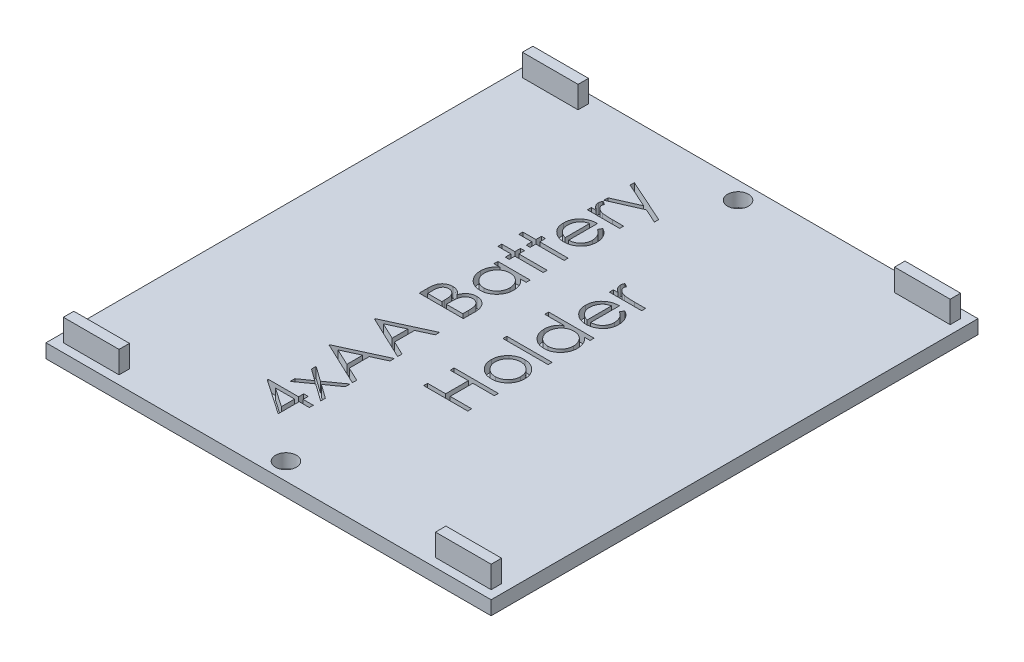
from build123d import *

# Parameters (mm, degrees)
SKETCH1_W               = 64
SKETCH1_H               = 70
BASE_DEPTH              = 2
SKETCH2_W               = 8
SKETCH2_H               = 1.5
BOSS_EXTRUDE2_DEPTH     = 3.175
MIRROR3_COPY_1_SKETCH_W = 8
MIRROR3_COPY_1_SKETCH_H = 1.5
MIRROR3_COPY_1_DEPTH    = 3.175
MIRROR3_COPY_2_SKETCH_W = 8
MIRROR3_COPY_2_SKETCH_H = 1.5
MIRROR3_COPY_2_DEPTH    = 3.175
SKETCH4_W               = 6.512820513
SKETCH4_H               = 0.569871795
LETTERS_DEPTH           = 1.5
SKETCH7_R               = 1.5
CUT_EXTRUDE3_DEPTH      = 48.529786854


with BuildPart() as part:
    # Sketch1 → Base (new body)
    with BuildSketch(Plane(origin=(0, 0, 0), x_dir=(1, 0, 0), z_dir=(0, 1, 0))):
        Rectangle(SKETCH1_W, SKETCH1_H)
    extrude(amount=BASE_DEPTH)

    # Sketch2 → Boss-Extrude2 (add)
    with BuildSketch(Plane(origin=(0, 2, 0), x_dir=(1, 0, 0), z_dir=(0, 1, 0))):
        with Locations((-26.75, 33)):
            Rectangle(SKETCH2_W, SKETCH2_H)
    boss_extrude2 = extrude(amount=BOSS_EXTRUDE2_DEPTH)

    # Mirror2: Boss-Extrude2 across plane
    add(boss_extrude2.mirror(Plane.XY))

    # Mirror3 copy 1 sketch → Mirror3 copy 1 (add)
    with BuildSketch(Plane(origin=(0, 2, 0), x_dir=(-1, 0, 0), z_dir=(0, 1, 0))):
        with Locations((-26.75, 33)):
            Rectangle(MIRROR3_COPY_1_SKETCH_W, MIRROR3_COPY_1_SKETCH_H)
    extrude(amount=MIRROR3_COPY_1_DEPTH)

    # Mirror3 copy 2 sketch → Mirror3 copy 2 (add)
    with BuildSketch(Plane(origin=(0, 2, 0), x_dir=(-1, 0, 0), z_dir=(0, 1, 0))):
        with Locations((-26.75, -33)):
            Rectangle(MIRROR3_COPY_2_SKETCH_W, MIRROR3_COPY_2_SKETCH_H)
    extrude(amount=MIRROR3_COPY_2_DEPTH)

    # Sketch4 → Letters (cut)
    # profile 1 of 17: a face of its own
    with BuildSketch(Plane(origin=(-14.943623663, 2, 1.769971189), x_dir=(1, 0, 0), z_dir=(0, 1, 0))):
        Polygon((3.43080315, -21.914053251), (3.43080315, -21.798298042), (7.826956997, -21.798298042), (7.826956997, -21.065605735), (8.478239048, -21.065605735), (8.478239048, -21.798298042), (9.943623663, -21.798298042), (9.943623663, -22.368169837), (8.478239048, -22.368169837), (8.478239048, -25.380349324), align=None)
        Polygon((7.826956997, -22.368169837), (5.069184561, -22.368169837), (7.826956997, -24.260958299), align=None, mode=Mode.SUBTRACT)
    # profile 2 of 17: a face of its own
    with BuildSketch(Plane(origin=(-14.943623663, 2, 1.769971189), x_dir=(1, 0, 0), z_dir=(0, 1, 0))):
        Polygon((5.303239048, -20.49573394), (5.303239048, -19.817739148), (6.977237445, -18.623298042), (5.303239048, -17.428856936), (5.303239048, -16.750862145), (7.451706596, -18.283664629), (9.943623663, -16.506631376), (9.943623663, -17.184626167), (7.927447782, -18.623298042), (9.943623663, -20.061969917), (9.943623663, -20.739964709), (7.451706596, -18.96165942), align=None)
    # profile 3 of 17: a face of its own
    with BuildSketch(Plane(origin=(-14.943623663, 2, 1.769971189), x_dir=(1, 0, 0), z_dir=(0, 1, 0))):
        Polygon((3.593623663, -13.087400606), (9.943623663, -10.156631376), (9.943623663, -10.776112545), (7.908367253, -11.714874565), (7.908367253, -14.59349035), (9.943623663, -15.55896511), (9.943623663, -16.18099035), (3.593623663, -13.168810863), align=None)
        Polygon((4.831313968, -13.134465911), (7.257085202, -14.284385783), (7.257085202, -12.015074885), align=None, mode=Mode.SUBTRACT)
    # profile 4 of 17: a face of its own
    with BuildSketch(Plane(origin=(-14.943623663, 2, 1.769971189), x_dir=(1, 0, 0), z_dir=(0, 1, 0))):
        Polygon((3.593623663, -6.574580093), (9.943623663, -3.643810863), (9.943623663, -4.263292033), (7.908367253, -5.202054052), (7.908367253, -8.080669837), (9.943623663, -9.046144597), (9.943623663, -9.668169837), (3.593623663, -6.65599035), align=None)
        Polygon((4.831313968, -6.621645398), (7.257085202, -7.77156527), (7.257085202, -5.502254372), align=None, mode=Mode.SUBTRACT)
    # profile 5 of 17: a face of its own
    with BuildSketch(Plane(origin=(-14.943623663, 2, 1.769971189), x_dir=(1, 0, 0), z_dir=(0, 1, 0))):
        with BuildLine():
            Line((3.593623663, -0.224580093), (3.593623663, 1.014382246))
            add(Edge.make_bspline(
                [(3.593623663, 1.014382246), (3.593937505, 1.075032013), (3.594545808, 1.192586356), (3.604199138, 1.363514344), (3.617032327, 1.52366793), (3.638559312, 1.672764102), (3.660879955, 1.811773006), (3.693641316, 1.93928341), (3.729827432, 2.056363373), (3.785504684, 2.196952443), (3.871972157, 2.356470008), (4.000211636, 2.527921542), (4.153960416, 2.676957677), (4.329169279, 2.803682568), (4.521918882, 2.90538199), (4.728062157, 2.978026234), (4.944130988, 3.024695663), (5.09226615, 3.029434985), (5.167131275, 3.031830163)],
                knots=[0, 0, 0, 0, 1.00128172, 1.940733171, 2.826250472, 3.653024905, 4.427672124, 5.149348099, 5.824709082, 6.450061444, 7.643590664, 8.808605388, 9.972104426, 11.165284501, 12.367876273, 13.557044126, 14.765369432, 16, 16, 16, 16], degree=3))
            add(Edge.make_bspline(
                [(5.167131275, 3.031830163), (5.237254972, 3.029835155), (5.375054648, 3.025914776), (5.576255016, 2.988883444), (5.767584804, 2.930109428), (5.948880263, 2.848881366), (6.116766562, 2.744223554), (6.270723634, 2.618828784), (6.40493275, 2.46816797), (6.479934982, 2.355232116), (6.518032718, 2.29786582)],
                knots=[0, 0, 0, 0, 1.044641374, 2.052818814, 3.038628718, 4.023282556, 5.005660861, 5.98021751, 6.974042014, 8, 8, 8, 8], degree=3))
            add(Edge.make_bspline(
                [(6.518032718, 2.29786582), (6.545736755, 2.36999563), (6.598741441, 2.507997825), (6.69230658, 2.698018531), (6.794441874, 2.8611364), (6.904255556, 3.000537857), (7.024368761, 3.119132412), (7.155757354, 3.221842155), (7.298313772, 3.310636729), (7.451514075, 3.386200297), (7.614059515, 3.445556422), (7.78396476, 3.489182351), (7.960578477, 3.514988037), (8.080432082, 3.518508328), (8.141149705, 3.520291701)],
                knots=[0, 0, 0, 0, 1.272586185, 2.434772614, 3.483318042, 4.437947805, 5.351807173, 6.25737843, 7.180033415, 8.1141739, 9.066731021, 10.025721652, 10.999834114, 12, 12, 12, 12], degree=3))
            add(Edge.make_bspline(
                [(8.141149705, 3.520291701), (8.203138425, 3.518519811), (8.325102969, 3.515033567), (8.504269396, 3.489301514), (8.675505755, 3.445762469), (8.839840724, 3.385687144), (8.99692975, 3.307819523), (9.146203753, 3.211687586), (9.287973294, 3.098640832), (9.422488579, 2.970879728), (9.545574294, 2.828499973), (9.6513865, 2.671588318), (9.742369917, 2.50444338), (9.816445371, 2.324928368), (9.873594534, 2.133501548), (9.913411782, 1.930269441), (9.940285601, 1.715566738), (9.942492096, 1.568227968), (9.943623663, 1.492667503)],
                knots=[0, 0, 0, 0, 0.978680899, 1.925582087, 2.851223405, 3.764209995, 4.683484765, 5.614004905, 6.562443559, 7.542772147, 8.539900013, 9.527881485, 10.525548727, 11.540192123, 12.58875426, 13.674701727, 14.807505862, 16, 16, 16, 16], degree=3))
            Line((9.943623663, 1.492667503), (9.943623663, -0.224580093))
            Line((9.943623663, -0.224580093), (3.593623663, -0.224580093))
        make_face()
        with BuildLine():
            Line((4.244905715, 0.345291701), (6.280162125, 0.345291701))
            Line((6.280162125, 0.345291701), (6.280162125, 0.728174314))
            add(Edge.make_bspline(
                [(6.280162125, 0.728174314), (6.27943655, 0.784142842), (6.278034593, 0.892285446), (6.274018639, 1.048894399), (6.262773622, 1.194264081), (6.251531816, 1.328143531), (6.233253688, 1.450322025), (6.211496381, 1.560528548), (6.188486516, 1.660493784), (6.149350985, 1.775769975), (6.091531512, 1.906549207), (6.001713294, 2.045874071), (5.894818274, 2.169270566), (5.770322499, 2.272222394), (5.634724709, 2.3572245), (5.489215326, 2.416771148), (5.336722536, 2.456469125), (5.231833895, 2.460109877), (5.178579593, 2.461958368)],
                knots=[0, 0, 0, 0, 1.156917035, 2.235399477, 3.236897345, 4.169954739, 5.01148057, 5.788325709, 6.491867502, 7.129259015, 8.302032419, 9.437271567, 10.542795419, 11.662606952, 12.764338259, 13.836858145, 14.901724648, 16, 16, 16, 16], degree=3))
            add(Edge.make_bspline(
                [(5.178579593, 2.461958368), (5.143331073, 2.461019818), (5.074187252, 2.45917875), (4.973064059, 2.443552627), (4.878045349, 2.418234161), (4.78821918, 2.383946133), (4.70581795, 2.337103598), (4.626904313, 2.282806946), (4.556204811, 2.215770021), (4.490315694, 2.140012343), (4.431345155, 2.053332047), (4.382497203, 1.953861605), (4.338224729, 1.844172479), (4.305451132, 1.721288744), (4.276631893, 1.587756592), (4.258524571, 1.441767949), (4.246872338, 1.284247913), (4.245575877, 1.175106313), (4.244905715, 1.118689137)],
                knots=[0, 0, 0, 0, 0.911708768, 1.788416306, 2.640049961, 3.452993646, 4.268229297, 5.087074648, 5.92553149, 6.781184137, 7.681934069, 8.628939405, 9.643570426, 10.73771997, 11.914765019, 13.176320755, 14.540391495, 16, 16, 16, 16], degree=3))
            Line((4.244905715, 1.118689137), (4.244905715, 0.345291701))
        make_face(mode=Mode.SUBTRACT)
        with BuildLine():
            Line((6.931444176, 0.345291701), (9.292341612, 0.345291701))
            Line((9.292341612, 0.345291701), (9.292341612, 1.156850195))
            add(Edge.make_bspline(
                [(9.292341612, 1.156850195), (9.291576156, 1.214935599), (9.290100841, 1.326887558), (9.28664092, 1.488654245), (9.273552564, 1.638195702), (9.261478615, 1.775983681), (9.240832681, 1.90165249), (9.221348288, 2.016168782), (9.192425097, 2.117652693), (9.152673574, 2.236412347), (9.089036321, 2.369158191), (8.996062895, 2.514225505), (8.881319334, 2.640721954), (8.750820264, 2.749307347), (8.609319449, 2.838916729), (8.458666742, 2.903219936), (8.301792052, 2.943180243), (8.194804951, 2.948001827), (8.141149705, 2.950419907)],
                knots=[0, 0, 0, 0, 1.160376723, 2.23647316, 3.230273494, 4.158083346, 4.997711197, 5.773399541, 6.476071462, 7.102777513, 8.27340052, 9.405620712, 10.53304798, 11.669441455, 12.787990954, 13.865552736, 14.929550474, 16, 16, 16, 16], degree=3))
            add(Edge.make_bspline(
                [(8.141149705, 2.950419907), (8.107596779, 2.949920508), (8.041032138, 2.948929768), (7.943223973, 2.933920287), (7.848432394, 2.912206324), (7.756262389, 2.883608411), (7.668263675, 2.843630071), (7.584098778, 2.794619976), (7.502072221, 2.738519214), (7.39703011, 2.651966351), (7.277506758, 2.524236404), (7.161931491, 2.342717897), (7.067218679, 2.137464505), (7.027178156, 1.988248325), (7.006494256, 1.911167102)],
                knots=[0, 0, 0, 0, 0.723302347, 1.434937762, 2.129609326, 2.821140842, 3.513216847, 4.209993937, 4.920569932, 5.655069131, 7.14393391, 8.6716197, 10.280644748, 12, 12, 12, 12], degree=3))
            add(Edge.make_bspline(
                [(7.006494256, 1.911167102), (7.000225747, 1.880271457), (6.986634325, 1.813283325), (6.972287492, 1.704049572), (6.95950574, 1.579343067), (6.950051212, 1.438875847), (6.940278483, 1.282470192), (6.936477879, 1.109792068), (6.931943507, 0.921546654), (6.931614877, 0.790931922), (6.931444176, 0.723086173)],
                knots=[0, 0, 0, 0, 0.634451884, 1.375622551, 2.216452059, 3.157844607, 4.20941857, 5.370758133, 6.634282058, 8, 8, 8, 8], degree=3))
            Line((6.931444176, 0.723086173), (6.931444176, 0.345291701))
        make_face(mode=Mode.SUBTRACT)
    # profile 6 of 17: a face of its own
    with BuildSketch(Plane(origin=(-14.943623663, 2, 1.769971189), x_dir=(1, 0, 0), z_dir=(0, 1, 0))):
        with BuildLine():
            Line((5.303239048, 9.381830163), (9.943623663, 9.381830163))
            Line((9.943623663, 9.381830163), (9.943623663, 8.811958368))
            Line((9.943623663, 8.811958368), (9.140969416, 8.811958368))
            add(Edge.make_bspline(
                [(9.140969416, 8.811958368), (9.213492983, 8.747598242), (9.355234107, 8.621811867), (9.542106959, 8.413704558), (9.693422684, 8.190368578), (9.817407586, 7.957408086), (9.910164545, 7.712541172), (9.976211859, 7.457047679), (10.018646129, 7.190683514), (10.022885553, 7.008797974), (10.02503392, 6.916625836)],
                knots=[0, 0, 0, 0, 1.074325654, 2.099677833, 3.090439787, 4.057542011, 5.018572219, 5.985274637, 6.979019747, 8, 8, 8, 8], degree=3))
            add(Edge.make_bspline(
                [(10.02503392, 6.916625836), (10.02280893, 6.834678263), (10.018421152, 6.673074019), (9.984380972, 6.435349837), (9.929715416, 6.20658247), (9.853695231, 5.986555745), (9.75285574, 5.776693424), (9.632130904, 5.575198677), (9.488365398, 5.383115365), (9.324012833, 5.203371287), (9.145496213, 5.037850372), (8.955095007, 4.892596349), (8.753632541, 4.771487189), (8.543659533, 4.670213614), (8.323559608, 4.592205961), (8.094093889, 4.537825225), (7.85553369, 4.5038247), (7.693083412, 4.499438735), (7.610711003, 4.497214778)],
                knots=[0, 0, 0, 0, 1.033919861, 2.038935746, 3.024066025, 3.998881131, 4.97069526, 5.957263378, 6.95902576, 7.993208707, 9.027059324, 10.027763471, 11.009749337, 11.988697705, 12.965288445, 13.950418724, 14.960734635, 16, 16, 16, 16], degree=3))
            add(Edge.make_bspline(
                [(7.610711003, 4.497214778), (7.530041141, 4.499488026), (7.370561175, 4.503982115), (7.13601268, 4.537461528), (6.910100979, 4.593760644), (6.693553382, 4.672768882), (6.486107862, 4.774082143), (6.287617702, 4.897323101), (6.097536081, 5.042500656), (5.92033257, 5.20987288), (5.756646598, 5.391183106), (5.614390187, 5.585146089), (5.491532476, 5.786936899), (5.39418974, 5.999685504), (5.315433222, 6.220242966), (5.260944837, 6.450572789), (5.22883684, 6.689716653), (5.224187253, 6.852077974), (5.221828791, 6.93443433)],
                knots=[0, 0, 0, 0, 1.020392517, 2.01726096, 2.990465484, 3.961182959, 4.928053699, 5.906110375, 6.912531644, 7.948652711, 8.985773172, 9.998621852, 10.987621588, 11.969261332, 12.953316658, 13.946091881, 14.958173133, 16, 16, 16, 16], degree=3))
            add(Edge.make_bspline(
                [(5.221828791, 6.93443433), (5.224440189, 7.029137994), (5.229561017, 7.214847411), (5.272088028, 7.48652216), (5.344153349, 7.743413224), (5.441504795, 7.98824775), (5.573578097, 8.217655653), (5.735521588, 8.434492721), (5.934030582, 8.63414573), (6.084605027, 8.751662182), (6.161862846, 8.811958368)],
                knots=[0, 0, 0, 0, 1.039007978, 2.037445607, 3.008437381, 3.96246474, 4.921201921, 5.904967172, 6.925065498, 8, 8, 8, 8], degree=3))
            Line((6.161862846, 8.811958368), (5.303239048, 8.811958368))
            Line((5.303239048, 8.811958368), (5.303239048, 9.381830163))
        make_face()
        with BuildLine():
            add(Edge.make_bspline(
                [(5.791700586, 6.942066541), (5.794667009, 6.858766607), (5.800522254, 6.694345785), (5.846157483, 6.452940027), (5.922285953, 6.222054541), (6.025791529, 6.002048356), (6.158411712, 5.799056485), (6.314662774, 5.614453935), (6.497182174, 5.453932723), (6.699438066, 5.315884868), (6.917464945, 5.205063312), (7.145304617, 5.126642139), (7.37901403, 5.075017599), (7.537512181, 5.069737132), (7.617071179, 5.067086573)],
                knots=[0, 0, 0, 0, 1.031130969, 2.035288524, 3.029955243, 4.035265425, 5.037320146, 6.024362013, 7.021230137, 8.037832003, 9.049975902, 10.039737725, 11.016035826, 12, 12, 12, 12], degree=3))
            add(Edge.make_bspline(
                [(7.617071179, 5.067086573), (7.696151093, 5.070483677), (7.854000955, 5.077264568), (8.087690308, 5.125511858), (8.315018545, 5.207516707), (8.534797458, 5.318188409), (8.739029616, 5.457860982), (8.924827274, 5.618229528), (9.083522447, 5.803720248), (9.216462346, 6.008526996), (9.323782373, 6.227364682), (9.398473247, 6.457472327), (9.446691717, 6.694556672), (9.45232429, 6.855760003), (9.455162125, 6.9369784)],
                knots=[0, 0, 0, 0, 0.979154007, 1.954470061, 2.941101473, 3.965068436, 4.993389179, 5.998216918, 6.996159742, 8.005560442, 9.015493761, 10.005250788, 10.994993882, 12, 12, 12, 12], degree=3))
            add(Edge.make_bspline(
                [(9.455162125, 6.9369784), (9.452115684, 7.019420106), (9.446056615, 7.183388483), (9.400679576, 7.425780007), (9.32286612, 7.660203795), (9.218292884, 7.885060707), (9.088044227, 8.094329082), (8.935558235, 8.281513704), (8.759437633, 8.441664554), (8.563630344, 8.575001855), (8.350335697, 8.680744849), (8.123478696, 8.758062776), (7.882598867, 8.803268515), (7.717752316, 8.809021699), (7.633607638, 8.811958368)],
                knots=[0, 0, 0, 0, 1.01787422, 2.024450869, 3.03297362, 4.061474925, 5.080076323, 6.069755756, 7.033548292, 8.009625779, 8.9862229, 9.964937832, 10.961217871, 12, 12, 12, 12], degree=3))
            add(Edge.make_bspline(
                [(7.633607638, 8.811958368), (7.569494717, 8.810217277), (7.443300199, 8.806790259), (7.258011703, 8.780609083), (7.0806948, 8.738962288), (6.911163064, 8.680277094), (6.750353822, 8.603185764), (6.597112428, 8.510207674), (6.452235888, 8.399707787), (6.317719173, 8.273464895), (6.195025449, 8.135279456), (6.085507469, 7.989057933), (5.995539267, 7.83306792), (5.921078675, 7.669932725), (5.861825645, 7.499369304), (5.822296544, 7.319989751), (5.795154247, 7.133700732), (5.792863928, 7.006617174), (5.791700586, 6.942066541)],
                knots=[0, 0, 0, 0, 1.050140795, 2.067009409, 3.05949893, 4.030605086, 5.00011959, 5.97591094, 6.962425594, 7.979863591, 8.993523472, 9.986985069, 10.967611495, 11.937549037, 12.921786183, 13.919465291, 14.943216303, 16, 16, 16, 16], degree=3))
        make_face(mode=Mode.SUBTRACT)
    # profile 7 of 17: a face of its own
    with BuildSketch(Plane(origin=(-14.943623663, 2, 1.769971189), x_dir=(1, 0, 0), z_dir=(0, 1, 0))):
        Polygon((3.43080315, 11.25426606), (3.43080315, 11.824137855), (5.303239048, 11.824137855), (5.303239048, 12.638240419), (5.873110843, 12.638240419), (5.873110843, 11.824137855), (9.943623663, 11.824137855), (9.943623663, 11.25426606), (5.873110843, 11.25426606), (5.873110843, 10.440163496), (5.303239048, 10.440163496), (5.303239048, 11.25426606), align=None)
    # profile 8 of 17: a face of its own
    with BuildSketch(Plane(origin=(-14.943623663, 2, 1.769971189), x_dir=(1, 0, 0), z_dir=(0, 1, 0))):
        Polygon((3.43080315, 14.266445548), (3.43080315, 14.836317342), (5.303239048, 14.836317342), (5.303239048, 15.650419907), (5.873110843, 15.650419907), (5.873110843, 14.836317342), (9.943623663, 14.836317342), (9.943623663, 14.266445548), (5.873110843, 14.266445548), (5.873110843, 13.452342983), (5.303239048, 13.452342983), (5.303239048, 14.266445548), align=None)
    # profile 9 of 17: a face of its own
    with BuildSketch(Plane(origin=(-14.943623663, 2, 1.769971189), x_dir=(1, 0, 0), z_dir=(0, 1, 0))):
        with BuildLine():
            Line((8.478239048, 20.517226798), (8.744094416, 21.02349683))
            add(Edge.make_bspline(
                [(8.744094416, 21.02349683), (8.815638925, 20.983132127), (8.954836207, 20.904598402), (9.146087265, 20.770092842), (9.317115506, 20.627801195), (9.465182278, 20.47339409), (9.595943623, 20.311524469), (9.708732595, 20.139117921), (9.805584315, 19.957581698), (9.884945262, 19.764916268), (9.947335425, 19.561352425), (9.993410987, 19.345708948), (10.020130434, 19.116967648), (10.023373372, 18.960325915), (10.02503392, 18.880117423)],
                knots=[0, 0, 0, 0, 1.120611642, 2.180266485, 3.186550691, 4.152466804, 5.095166165, 6.022949561, 6.960161436, 7.899497276, 8.862391909, 9.862399089, 10.905440174, 12, 12, 12, 12], degree=3))
            add(Edge.make_bspline(
                [(10.02503392, 18.880117423), (10.022952616, 18.790959835), (10.018892595, 18.61703921), (9.983890553, 18.363874239), (9.926790699, 18.125514444), (9.847024656, 17.901973184), (9.742835044, 17.69379805), (9.615908699, 17.500574716), (9.466896778, 17.321289207), (9.294511869, 17.161583033), (9.110024079, 17.017830943), (8.917817546, 16.890897019), (8.718557901, 16.785269796), (8.513430696, 16.698035348), (8.302902063, 16.629223898), (8.085766278, 16.580325422), (7.862884348, 16.552397852), (7.712125173, 16.548099058), (7.636151708, 16.545932727)],
                knots=[0, 0, 0, 0, 1.14524686, 2.234044844, 3.276713788, 4.290115724, 5.276966211, 6.260758605, 7.254862358, 8.264742877, 9.274005885, 10.257798278, 11.220590477, 12.167824544, 13.118936889, 14.062732937, 15.023735098, 16, 16, 16, 16], degree=3))
            add(Edge.make_bspline(
                [(7.636151708, 16.545932727), (7.564859659, 16.547854312), (7.423568231, 16.55166264), (7.214443601, 16.575667068), (7.01119198, 16.618208971), (6.813644481, 16.676586016), (6.622131867, 16.751971849), (6.43653758, 16.844196018), (6.257059112, 16.953402189), (6.143841998, 17.037716897), (6.086812766, 17.080187535)],
                knots=[0, 0, 0, 0, 1.024358464, 2.0301432, 3.019427413, 4.004406732, 4.986367066, 5.972626655, 6.978780325, 8, 8, 8, 8], degree=3))
            add(Edge.make_bspline(
                [(6.086812766, 17.080187535), (6.017993899, 17.137615155), (5.882757229, 17.250466769), (5.70668112, 17.443319463), (5.556063061, 17.649331207), (5.433188551, 17.870574231), (5.338678625, 18.106675865), (5.271454965, 18.356418315), (5.229625333, 18.62049186), (5.22446715, 18.801517165), (5.221828791, 18.89410981)],
                knots=[0, 0, 0, 0, 1.030811313, 2.025658015, 2.997072178, 3.962767568, 4.930766827, 5.917075773, 6.934604948, 8, 8, 8, 8], degree=3))
            add(Edge.make_bspline(
                [(5.221828791, 18.89410981), (5.224273119, 18.989270223), (5.229068333, 19.17595326), (5.27392138, 19.448077087), (5.344186372, 19.706071974), (5.446559129, 19.947808821), (5.573457155, 20.177012436), (5.733850318, 20.388407725), (5.919500635, 20.587797624), (6.062422456, 20.703733901), (6.135150106, 20.762729602)],
                knots=[0, 0, 0, 0, 1.056389096, 2.072394598, 3.055233004, 4.020130009, 4.981825462, 5.957811105, 6.960805292, 8, 8, 8, 8], degree=3))
            add(Edge.make_bspline(
                [(6.135150106, 20.762729602), (6.189948032, 20.80287419), (6.299179133, 20.882896152), (6.477289661, 20.983130176), (6.663636025, 21.070138593), (6.861230421, 21.139685536), (7.067731659, 21.19600006), (7.28461599, 21.236743145), (7.51181883, 21.260636596), (7.66662558, 21.265333233), (7.74554674, 21.267727599)],
                knots=[0, 0, 0, 0, 0.94817472, 1.890038105, 2.849395472, 3.817997239, 4.812318967, 5.836947057, 6.897266129, 8, 8, 8, 8], degree=3))
            Line((7.74554674, 21.267727599), (7.74554674, 17.115804522))
            add(Edge.make_bspline(
                [(7.74554674, 17.115804522), (7.806689011, 17.118597808), (7.926922821, 17.124090692), (8.102855527, 17.149699595), (8.270447162, 17.190065227), (8.428440681, 17.246796241), (8.578899627, 17.315497517), (8.720707894, 17.39965446), (8.853219567, 17.500056223), (8.977619945, 17.612044277), (9.088401612, 17.736698579), (9.187555549, 17.867840134), (9.270659989, 18.007347031), (9.338114931, 18.154119268), (9.390922105, 18.307919507), (9.426968008, 18.468796204), (9.451110902, 18.636432786), (9.453795437, 18.750706904), (9.455162125, 18.808883448)],
                knots=[0, 0, 0, 0, 1.094153842, 2.151609401, 3.174256925, 4.172055639, 5.149267565, 6.128595816, 7.11444997, 8.118368179, 9.117203808, 10.09244225, 11.054858984, 12.015122123, 12.976791628, 13.957293641, 14.960065497, 16, 16, 16, 16], degree=3))
            add(Edge.make_bspline(
                [(9.455162125, 18.808883448), (9.45406782, 18.865765869), (9.451896509, 18.978631504), (9.430480609, 19.14667193), (9.396538265, 19.312281418), (9.347650967, 19.473815512), (9.290404601, 19.628920054), (9.223025997, 19.773348842), (9.146206762, 19.905192453), (9.058911323, 20.028898318), (8.951776893, 20.148237328), (8.819368102, 20.268496367), (8.660183165, 20.39459961), (8.54116933, 20.474812876), (8.478239048, 20.517226798)],
                knots=[0, 0, 0, 0, 0.991168677, 1.966668791, 2.94808785, 3.9350306, 4.905702032, 5.828266021, 6.709360349, 7.562606342, 8.463112863, 9.498839253, 10.677475166, 12, 12, 12, 12], degree=3))
        make_face()
        with BuildLine():
            add(Edge.make_bspline(
                [(7.175674945, 20.697855804), (7.100048815, 20.677082109), (6.954871215, 20.637203363), (6.75390558, 20.552274645), (6.574269929, 20.458933184), (6.418949407, 20.346568432), (6.280783152, 20.220499492), (6.161971797, 20.072869714), (6.052465649, 19.910081972), (5.961273096, 19.728893863), (5.886334769, 19.536450543), (5.831231933, 19.336707481), (5.798840835, 19.13133771), (5.794091857, 18.993016192), (5.791700586, 18.923366621)],
                knots=[0, 0, 0, 0, 1.155085888, 2.217389643, 3.210301801, 4.133263417, 5.03575695, 5.95948047, 6.920061569, 7.923798377, 8.943125483, 9.960783337, 10.973185325, 12, 12, 12, 12], degree=3))
            add(Edge.make_bspline(
                [(5.791700586, 18.923366621), (5.792797392, 18.866485437), (5.794965548, 18.754043293), (5.815962612, 18.588459866), (5.849702564, 18.429028905), (5.899311968, 18.276226305), (5.959676808, 18.129038469), (6.033877411, 17.987571752), (6.123587238, 17.853644735), (6.192116106, 17.769940539), (6.226736644, 17.72765348)],
                knots=[0, 0, 0, 0, 1.048823158, 2.073302879, 3.073550078, 4.050623576, 5.03253758, 6.005186856, 6.992227572, 8, 8, 8, 8], degree=3))
            add(Edge.make_bspline(
                [(6.226736644, 17.72765348), (6.254119167, 17.697362351), (6.30953472, 17.636060487), (6.405064062, 17.554236768), (6.50813463, 17.475309189), (6.623245548, 17.405170535), (6.747058724, 17.338514156), (6.880477593, 17.277772912), (7.024065319, 17.222544161), (7.12417164, 17.191540916), (7.175674945, 17.175590179)],
                knots=[0, 0, 0, 0, 0.879905587, 1.780714457, 2.708106151, 3.677566983, 4.684151534, 5.740052498, 6.837288539, 8, 8, 8, 8], degree=3))
            Line((7.175674945, 17.175590179), (7.175674945, 20.697855804))
        make_face(mode=Mode.SUBTRACT)
    # profile 10 of 17: a face of its own
    with BuildSketch(Plane(origin=(-14.943623663, 2, 1.769971189), x_dir=(1, 0, 0), z_dir=(0, 1, 0))):
        with BuildLine():
            Line((5.303239048, 22.244650676), (5.303239048, 22.814522471))
            Line((5.303239048, 22.814522471), (5.986321981, 22.814522471))
            add(Edge.make_bspline(
                [(5.986321981, 22.814522471), (5.922692219, 22.856566585), (5.801000795, 22.936975628), (5.640272101, 23.071250583), (5.505675407, 23.207321239), (5.399777493, 23.348760562), (5.31974453, 23.494181848), (5.263507873, 23.642358839), (5.228633812, 23.793653878), (5.22410017, 23.895572217), (5.221828791, 23.946633849)],
                knots=[0, 0, 0, 0, 1.280091057, 2.448164201, 3.510831157, 4.48793739, 5.405868014, 6.289422536, 7.142991551, 8, 8, 8, 8], degree=3))
            add(Edge.make_bspline(
                [(5.221828791, 23.946633849), (5.223988747, 23.986233041), (5.228432995, 24.067710953), (5.259658349, 24.191050794), (5.309511333, 24.318129629), (5.356392879, 24.400030817), (5.380833199, 24.442727599)],
                knots=[0, 0, 0, 0, 0.901110191, 1.854092781, 2.881294221, 4, 4, 4, 4], degree=3))
            Line((5.380833199, 24.442727599), (5.874382878, 24.129806926))
            add(Edge.make_bspline(
                [(5.874382878, 24.129806926), (5.862154109, 24.102394845), (5.838941566, 24.050361467), (5.811469633, 23.974243897), (5.795293614, 23.9040649), (5.792843027, 23.859354444), (5.791700586, 23.838510852)],
                knots=[0, 0, 0, 0, 1.180555205, 2.24091978, 3.179933427, 4, 4, 4, 4], degree=3))
            add(Edge.make_bspline(
                [(5.791700586, 23.838510852), (5.794724784, 23.79276672), (5.800893271, 23.69946195), (5.850079764, 23.56293453), (5.927264592, 23.42926635), (6.015155291, 23.324131697), (6.099581993, 23.242440101), (6.173473976, 23.183689577), (6.257095864, 23.130960107), (6.347215485, 23.079811122), (6.446094586, 23.032289852), (6.553894475, 22.989822617), (6.669724982, 22.950107577), (6.750264633, 22.927741897), (6.791520298, 22.916285291)],
                knots=[0, 0, 0, 0, 1.125322384, 2.295331465, 3.535939348, 4.916963136, 5.656144286, 6.429838446, 7.238666481, 8.090384391, 8.983239461, 9.940052224, 10.944811494, 12, 12, 12, 12], degree=3))
            add(Edge.make_bspline(
                [(6.791520298, 22.916285291), (6.828306848, 22.907684539), (6.910194857, 22.888538996), (7.046950996, 22.870420826), (7.208419934, 22.851798302), (7.394789248, 22.839080993), (7.606775347, 22.827067798), (7.843463722, 22.820431214), (8.105504914, 22.814733623), (8.288277618, 22.814595101), (8.384108439, 22.814522471)],
                knots=[0, 0, 0, 0, 0.566841273, 1.261806378, 2.068780918, 3.007109044, 4.065315289, 5.256255371, 6.561408263, 8, 8, 8, 8], degree=3))
            Line((8.384108439, 22.814522471), (9.943623663, 22.814522471))
            Line((9.943623663, 22.814522471), (9.943623663, 22.244650676))
            Line((9.943623663, 22.244650676), (5.303239048, 22.244650676))
        make_face()
    # profile 11 of 17: a face of its own
    with BuildSketch(Plane(origin=(-14.943623663, 2, 1.769971189), x_dir=(1, 0, 0), z_dir=(0, 1, 0))):
        Polygon((5.303239048, 24.605548112), (5.303239048, 25.21994114), (8.857305554, 26.790904682), (5.303239048, 28.386036894), (5.303239048, 29.001701958), (11.653239048, 26.152342983), (11.653239048, 25.536677919), (9.548020699, 26.481800115), align=None)
    # profile 12 of 17: a face of its own
    with BuildSketch(Plane(origin=(-14.943623663, 2, 1.769971189), x_dir=(1, 0, 0), z_dir=(0, 1, 0))):
        Polygon((15.421187766, -11.41849035), (15.421187766, -10.848618555), (18.026315971, -10.848618555), (18.026315971, -7.592208299), (15.421187766, -7.592208299), (15.421187766, -7.022336504), (21.771187766, -7.022336504), (21.771187766, -7.592208299), (18.677598022, -7.592208299), (18.677598022, -10.848618555), (21.771187766, -10.848618555), (21.771187766, -11.41849035), align=None)
    # profile 13 of 17: a face of its own
    with BuildSketch(Plane(origin=(-14.943623663, 2, 1.769971189), x_dir=(1, 0, 0), z_dir=(0, 1, 0))):
        with BuildLine():
            add(Edge.make_bspline(
                [(17.049392894, -3.315625767), (17.051246897, -3.228555886), (17.054882142, -3.057833129), (17.093735009, -2.80781025), (17.153148084, -2.569149789), (17.235283632, -2.340937697), (17.345378028, -2.126096704), (17.476749171, -1.921497447), (17.632383305, -1.727700874), (17.7527758, -1.611544806), (17.813886083, -1.552584901)],
                knots=[0, 0, 0, 0, 1.054011418, 2.066658804, 3.057071809, 4.030435133, 4.997543892, 5.974964718, 6.972108034, 8, 8, 8, 8], degree=3))
            add(Edge.make_bspline(
                [(17.813886083, -1.552584901), (17.872331457, -1.501817642), (17.988091127, -1.401265609), (18.175789167, -1.272332091), (18.370171921, -1.161258689), (18.573820643, -1.072244459), (18.784957546, -1.002058774), (19.004308338, -0.952228153), (19.231388596, -0.922588286), (19.385609845, -0.918591474), (19.463715811, -0.916567273)],
                knots=[0, 0, 0, 0, 1.025258237, 2.030674902, 3.01204498, 3.988269485, 4.97094183, 5.956517959, 6.965070386, 8, 8, 8, 8], degree=3))
            add(Edge.make_bspline(
                [(19.463715811, -0.916567273), (19.542274487, -0.918347699), (19.697510094, -0.921865905), (19.926145229, -0.955146466), (20.147841551, -1.006910007), (20.361670895, -1.080990628), (20.568286882, -1.175983198), (20.766787064, -1.291899159), (20.957563077, -1.42955195), (21.138994984, -1.585587773), (21.306210831, -1.758039034), (21.451949263, -1.945121189), (21.576811171, -2.143157793), (21.677388668, -2.354782163), (21.756690553, -2.578061746), (21.812389154, -2.813478141), (21.846065352, -3.060665626), (21.850389835, -3.229443584), (21.852598022, -3.315625767)],
                knots=[0, 0, 0, 0, 0.998656419, 1.973391657, 2.932242238, 3.890759089, 4.846373663, 5.82037756, 6.809684879, 7.83454468, 8.860553229, 9.859544525, 10.845671541, 11.83227036, 12.833544569, 13.85385346, 14.904124723, 16, 16, 16, 16], degree=3))
            add(Edge.make_bspline(
                [(21.852598022, -3.315625767), (21.850382423, -3.402230186), (21.846043061, -3.571849317), (21.812519991, -3.819909313), (21.756716223, -4.055747622), (21.677128057, -4.279319508), (21.576807956, -4.49185373), (21.452326748, -4.691037803), (21.306167609, -4.878271936), (21.139006695, -5.050759679), (20.95756006, -5.20678572), (20.766787847, -5.344441035), (20.568286678, -5.460356341), (20.361670949, -5.555349082), (20.147841536, -5.629429657), (19.926145233, -5.681193211), (19.697510093, -5.714473769), (19.542274486, -5.717991975), (19.463715811, -5.719772401)],
                knots=[0, 0, 0, 0, 1.099876186, 2.154163076, 3.173186993, 4.173200201, 5.163417411, 6.152872554, 7.150605724, 8.17532212, 9.198891216, 10.186952605, 11.159729845, 12.11414092, 13.071450619, 14.029093627, 15.002601286, 16, 16, 16, 16], degree=3))
            add(Edge.make_bspline(
                [(19.463715811, -5.719772401), (19.38603263, -5.717739237), (19.232233282, -5.713713922), (19.005605049, -5.684033605), (18.786925598, -5.63474518), (18.576941672, -5.56358652), (18.373782416, -5.474737528), (18.178686949, -5.364782032), (17.991809071, -5.234601298), (17.876202912, -5.134439908), (17.817702189, -5.083754773)],
                knots=[0, 0, 0, 0, 1.031377469, 2.041950136, 3.029500481, 4.003457997, 4.981637986, 5.969878303, 6.97268806, 8, 8, 8, 8], degree=3))
            add(Edge.make_bspline(
                [(17.817702189, -5.083754773), (17.756061942, -5.024883758), (17.63483555, -4.909103548), (17.479655114, -4.714342285), (17.345550237, -4.510246352), (17.237643389, -4.293031129), (17.152664935, -4.065006515), (17.093581786, -3.825123032), (17.055022128, -3.57425174), (17.051288005, -3.40269357), (17.049392894, -3.315625767)],
                knots=[0, 0, 0, 0, 1.027980169, 2.021703884, 2.998553061, 3.971491411, 4.943284454, 5.930300938, 6.949603206, 8, 8, 8, 8], degree=3))
        make_face()
        with BuildLine():
            add(Edge.make_bspline(
                [(17.619264689, -3.318169837), (17.621014734, -3.379742361), (17.624469646, -3.501297923), (17.650747589, -3.680222025), (17.692380914, -3.852470597), (17.751533999, -4.018370388), (17.827913387, -4.177362097), (17.921727291, -4.329597363), (18.03173216, -4.475526196), (18.157759762, -4.61228535), (18.295416774, -4.737822044), (18.442131896, -4.847473367), (18.595657756, -4.941237058), (18.756225383, -5.01793019), (18.924382252, -5.076748377), (19.099138083, -5.118428061), (19.281020577, -5.14475412), (19.404687936, -5.148166526), (19.467531916, -5.149900606)],
                knots=[0, 0, 0, 0, 1.02155314, 2.01673505, 2.994700672, 3.958461264, 4.934171024, 5.916582427, 6.921469794, 7.962398674, 8.998583302, 10.009097305, 10.997513862, 11.97957236, 12.956600784, 13.948243505, 14.957359924, 16, 16, 16, 16], degree=3))
            add(Edge.make_bspline(
                [(19.467531916, -5.149900606), (19.54872488, -5.146985369), (19.70987773, -5.141199169), (19.947206481, -5.09414524), (20.175047841, -5.015430132), (20.392066142, -4.909136067), (20.592857275, -4.775956213), (20.771875539, -4.619043964), (20.92642694, -4.440083364), (21.054662188, -4.241207714), (21.156552031, -4.026479166), (21.228758744, -3.799228412), (21.275697386, -3.562208867), (21.280362775, -3.400228112), (21.282726227, -3.318169837)],
                knots=[0, 0, 0, 0, 1.016792936, 2.018143844, 3.017858371, 4.030088057, 5.03801393, 6.028138512, 7.003788237, 7.991172063, 8.984598303, 9.972568034, 10.972917682, 12, 12, 12, 12], degree=3))
            add(Edge.make_bspline(
                [(21.282726227, -3.318169837), (21.280349005, -3.236116282), (21.275656433, -3.074144844), (21.228995146, -2.837454623), (21.156235647, -2.610824988), (21.05477678, -2.396319471), (20.925939971, -2.197534347), (20.772748258, -2.017286656), (20.592383128, -1.861714176), (20.391800183, -1.728666064), (20.175384287, -1.620631259), (19.94716443, -1.542284593), (19.70988844, -1.495117544), (19.548728468, -1.489346612), (19.467531916, -1.486439068)],
                knots=[0, 0, 0, 0, 1.02726834, 2.027799167, 3.010890988, 4.004497153, 4.992059811, 5.971914811, 6.958719428, 7.966827853, 8.981595046, 9.981490638, 10.983022906, 12, 12, 12, 12], degree=3))
            add(Edge.make_bspline(
                [(19.467531916, -1.486439068), (19.404687561, -1.48817255), (19.281019464, -1.491583779), (19.099142341, -1.5179184), (18.924366675, -1.559566468), (18.756282748, -1.618500917), (18.595241164, -1.694853383), (18.442581926, -1.790419573), (18.294908661, -1.899623033), (18.158204773, -2.026674304), (18.031683035, -2.163290717), (17.921684633, -2.309278686), (17.828325689, -2.461288214), (17.750880696, -2.619818023), (17.692919081, -2.785739085), (17.650507196, -2.957746312), (17.624580695, -3.135907008), (17.621048024, -3.257026987), (17.619264689, -3.318169837)],
                knots=[0, 0, 0, 0, 1.042975879, 2.052417305, 3.044379404, 4.0217225, 5.00409729, 5.996508862, 7.007348322, 8.048612455, 9.089876587, 10.095087598, 11.077815406, 12.047498138, 13.018202342, 13.98964644, 14.985148868, 16, 16, 16, 16], degree=3))
        make_face(mode=Mode.SUBTRACT)
    # profile 14 of 17: a face of its own
    with BuildSketch(Plane(origin=(-14.943623663, 2, 1.769971189), x_dir=(1, 0, 0), z_dir=(0, 1, 0))):
        with Locations((18.51477751, 0.426701958)):
            Rectangle(SKETCH4_W, SKETCH4_H)
    # profile 15 of 17: a face of its own
    with BuildSketch(Plane(origin=(-14.943623663, 2, 1.769971189), x_dir=(1, 0, 0), z_dir=(0, 1, 0))):
        with BuildLine():
            Line((15.258367253, 6.73599683), (21.771187766, 6.73599683))
            Line((21.771187766, 6.73599683), (21.771187766, 6.166125035))
            Line((21.771187766, 6.166125035), (20.968533519, 6.166125035))
            add(Edge.make_bspline(
                [(20.968533519, 6.166125035), (21.041057086, 6.101764909), (21.182798209, 5.975978533), (21.369671062, 5.767871224), (21.520986787, 5.544535245), (21.644971689, 5.311574752), (21.737728647, 5.066707839), (21.803775961, 4.811214346), (21.846210232, 4.54485018), (21.850449656, 4.362964641), (21.852598022, 4.270792503)],
                knots=[0, 0, 0, 0, 1.074325654, 2.099677833, 3.090439787, 4.057542011, 5.018572219, 5.985274637, 6.979019747, 8, 8, 8, 8], degree=3))
            add(Edge.make_bspline(
                [(21.852598022, 4.270792503), (21.850373033, 4.188844929), (21.845985254, 4.027240686), (21.811945075, 3.789516503), (21.757279519, 3.560749136), (21.681259333, 3.340722412), (21.580419843, 3.130860091), (21.459695007, 2.929365344), (21.315929501, 2.737282031), (21.151576935, 2.557537953), (20.973060316, 2.392017038), (20.782659109, 2.246763015), (20.581196643, 2.125653856), (20.371223636, 2.024380281), (20.15112371, 1.946372628), (19.921657991, 1.891991891), (19.683097792, 1.857991366), (19.520647515, 1.853605402), (19.438275106, 1.851381445)],
                knots=[0, 0, 0, 0, 1.033919861, 2.038935746, 3.024066025, 3.998881131, 4.97069526, 5.957263378, 6.95902576, 7.993208707, 9.027059324, 10.027763471, 11.009749337, 11.988697705, 12.965288445, 13.950418724, 14.960734635, 16, 16, 16, 16], degree=3))
            add(Edge.make_bspline(
                [(19.438275106, 1.851381445), (19.357605243, 1.853654693), (19.198125278, 1.858148782), (18.963576783, 1.891628195), (18.737665081, 1.947927311), (18.521117484, 2.026935549), (18.313671965, 2.12824881), (18.115181805, 2.251489768), (17.925100184, 2.396667322), (17.747896672, 2.564039547), (17.584210701, 2.745349773), (17.44195429, 2.939312756), (17.319096578, 3.141103566), (17.221753843, 3.353852171), (17.142997324, 3.574409633), (17.088508939, 3.804739456), (17.056400942, 4.04388332), (17.051751356, 4.206244641), (17.049392894, 4.288600996)],
                knots=[0, 0, 0, 0, 1.020392517, 2.01726096, 2.990465484, 3.961182959, 4.928053699, 5.906110375, 6.912531644, 7.948652711, 8.985773172, 9.998621852, 10.987621588, 11.969261332, 12.953316658, 13.946091881, 14.958173133, 16, 16, 16, 16], degree=3))
            add(Edge.make_bspline(
                [(17.049392894, 4.288600996), (17.052199807, 4.383347462), (17.057709466, 4.569324245), (17.104841688, 4.841016575), (17.181206883, 5.09868211), (17.288576108, 5.34287146), (17.429501888, 5.571443336), (17.597499484, 5.788192795), (17.799593376, 5.987660987), (17.951272664, 6.105730047), (18.028860041, 6.166125035)],
                knots=[0, 0, 0, 0, 1.030935089, 2.023611011, 2.991955418, 3.950956655, 4.918431382, 5.908366361, 6.930082213, 8, 8, 8, 8], degree=3))
            Line((18.028860041, 6.166125035), (15.258367253, 6.166125035))
            Line((15.258367253, 6.166125035), (15.258367253, 6.73599683))
        make_face()
        with BuildLine():
            add(Edge.make_bspline(
                [(17.619264689, 4.296233208), (17.622231111, 4.212933273), (17.628086357, 4.048512452), (17.673721585, 3.807106694), (17.749850056, 3.576221207), (17.853355632, 3.356215023), (17.985975815, 3.153223152), (18.142226877, 2.968620602), (18.324746276, 2.80809939), (18.527002169, 2.670051535), (18.745029048, 2.559229979), (18.972868719, 2.480808806), (19.206578133, 2.429184265), (19.365076284, 2.423903799), (19.444635282, 2.42125324)],
                knots=[0, 0, 0, 0, 1.031130969, 2.035288524, 3.029955243, 4.035265425, 5.037320146, 6.024362013, 7.021230137, 8.037832003, 9.049975902, 10.039737725, 11.016035826, 12, 12, 12, 12], degree=3))
            add(Edge.make_bspline(
                [(19.444635282, 2.42125324), (19.523715196, 2.424650343), (19.681565057, 2.431431235), (19.91525441, 2.479678524), (20.142582647, 2.561683374), (20.362361561, 2.672355076), (20.566593718, 2.812027649), (20.752391377, 2.972396195), (20.91108655, 3.157886915), (21.044026448, 3.362693663), (21.151346476, 3.581531349), (21.22603735, 3.811638994), (21.27425582, 4.048723339), (21.279888392, 4.20992667), (21.282726227, 4.291145067)],
                knots=[0, 0, 0, 0, 0.979154007, 1.954470061, 2.941101473, 3.965068436, 4.993389179, 5.998216918, 6.996159742, 8.005560442, 9.015493761, 10.005250788, 10.994993882, 12, 12, 12, 12], degree=3))
            add(Edge.make_bspline(
                [(21.282726227, 4.291145067), (21.279679787, 4.373586773), (21.273620718, 4.53755515), (21.228243678, 4.779946673), (21.150430222, 5.014370462), (21.045856986, 5.239227374), (20.915608329, 5.448495748), (20.763122338, 5.635680371), (20.587001736, 5.79583122), (20.391194447, 5.929168521), (20.1778998, 6.034911516), (19.951042798, 6.112229442), (19.71016297, 6.157435182), (19.545316419, 6.163188366), (19.46117174, 6.166125035)],
                knots=[0, 0, 0, 0, 1.01787422, 2.024450869, 3.03297362, 4.061474925, 5.080076323, 6.069755756, 7.033548292, 8.009625779, 8.9862229, 9.964937832, 10.961217871, 12, 12, 12, 12], degree=3))
            add(Edge.make_bspline(
                [(19.46117174, 6.166125035), (19.397058819, 6.164383944), (19.270864301, 6.160956926), (19.085575805, 6.13477575), (18.908258902, 6.093128955), (18.738727167, 6.034443761), (18.577917924, 5.95735243), (18.424676531, 5.864374341), (18.27979999, 5.753874454), (18.145283276, 5.627631562), (18.022589551, 5.489446123), (17.913071572, 5.343224599), (17.82310337, 5.187234587), (17.748642777, 5.024099392), (17.689389748, 4.85353597), (17.649860646, 4.674156417), (17.62271835, 4.487867398), (17.62042803, 4.360783841), (17.619264689, 4.296233208)],
                knots=[0, 0, 0, 0, 1.050140795, 2.067009409, 3.05949893, 4.030605086, 5.00011959, 5.97591094, 6.962425594, 7.979863591, 8.993523472, 9.986985069, 10.967611495, 11.937549037, 12.921786183, 13.919465291, 14.943216303, 16, 16, 16, 16], degree=3))
        make_face(mode=Mode.SUBTRACT)
    # profile 16 of 17: a face of its own
    with BuildSketch(Plane(origin=(-14.943623663, 2, 1.769971189), x_dir=(1, 0, 0), z_dir=(0, 1, 0))):
        with BuildLine():
            Line((20.30580315, 11.84703449), (20.571658519, 12.353304522))
            add(Edge.make_bspline(
                [(20.571658519, 12.353304522), (20.643203028, 12.31293982), (20.78240031, 12.234406094), (20.973651367, 12.099900535), (21.144679609, 11.957608887), (21.29274638, 11.803201783), (21.423507725, 11.641332161), (21.536296698, 11.468925614), (21.633148418, 11.28738939), (21.712509365, 11.094723961), (21.774899528, 10.891160118), (21.820975089, 10.67551664), (21.847694537, 10.44677534), (21.850937474, 10.290133608), (21.852598022, 10.209925115)],
                knots=[0, 0, 0, 0, 1.120611642, 2.180266485, 3.186550691, 4.152466804, 5.095166165, 6.022949561, 6.960161436, 7.899497276, 8.862391909, 9.862399089, 10.905440174, 12, 12, 12, 12], degree=3))
            add(Edge.make_bspline(
                [(21.852598022, 10.209925115), (21.850516718, 10.120767527), (21.846456697, 9.946846903), (21.811454656, 9.693681931), (21.754354802, 9.455322136), (21.674588759, 9.231780877), (21.570399146, 9.023605743), (21.443472802, 8.830382408), (21.294460881, 8.651096899), (21.122075972, 8.491390726), (20.937588181, 8.347638635), (20.745381648, 8.220704711), (20.546122003, 8.115077489), (20.340994799, 8.02784304), (20.130466165, 7.959031591), (19.913330381, 7.910133114), (19.690448451, 7.882205545), (19.539689276, 7.87790675), (19.463715811, 7.875740419)],
                knots=[0, 0, 0, 0, 1.14524686, 2.234044844, 3.276713788, 4.290115724, 5.276966211, 6.260758605, 7.254862358, 8.264742877, 9.274005885, 10.257798278, 11.220590477, 12.167824544, 13.118936889, 14.062732937, 15.023735098, 16, 16, 16, 16], degree=3))
            add(Edge.make_bspline(
                [(19.463715811, 7.875740419), (19.392423761, 7.877662004), (19.251132334, 7.881470332), (19.042007703, 7.905474761), (18.838756082, 7.948016664), (18.641208584, 8.006393709), (18.449695969, 8.081779541), (18.264101682, 8.17400371), (18.084623214, 8.283209881), (17.9714061, 8.367524589), (17.914376868, 8.409995227)],
                knots=[0, 0, 0, 0, 1.024358464, 2.0301432, 3.019427413, 4.004406732, 4.986367066, 5.972626655, 6.978780325, 8, 8, 8, 8], degree=3))
            add(Edge.make_bspline(
                [(17.914376868, 8.409995227), (17.845558001, 8.467422848), (17.710321331, 8.580274461), (17.534245223, 8.773127155), (17.383627164, 8.979138899), (17.260752653, 9.200381924), (17.166242728, 9.436483558), (17.099019067, 9.686226007), (17.057189435, 9.950299553), (17.052031253, 10.131324858), (17.049392894, 10.223917503)],
                knots=[0, 0, 0, 0, 1.030811313, 2.025658015, 2.997072178, 3.962767568, 4.930766827, 5.917075773, 6.934604948, 8, 8, 8, 8], degree=3))
            add(Edge.make_bspline(
                [(17.049392894, 10.223917503), (17.051837222, 10.319077915), (17.056632436, 10.505760952), (17.101485482, 10.777884779), (17.171750474, 11.035879667), (17.274123232, 11.277616513), (17.401021258, 11.506820129), (17.56141442, 11.718215417), (17.747064738, 11.917605317), (17.889986558, 12.033541593), (17.962714208, 12.092537294)],
                knots=[0, 0, 0, 0, 1.056389096, 2.072394598, 3.055233004, 4.020130009, 4.981825462, 5.957811105, 6.960805292, 8, 8, 8, 8], degree=3))
            add(Edge.make_bspline(
                [(17.962714208, 12.092537294), (18.017512134, 12.132681882), (18.126743235, 12.212703844), (18.304853763, 12.312937869), (18.491200127, 12.399946285), (18.688794523, 12.469493229), (18.895295762, 12.525807752), (19.112180093, 12.566550838), (19.339382932, 12.590444289), (19.494189683, 12.595140925), (19.573110843, 12.597535291)],
                knots=[0, 0, 0, 0, 0.94817472, 1.890038105, 2.849395472, 3.817997239, 4.812318967, 5.836947057, 6.897266129, 8, 8, 8, 8], degree=3))
            Line((19.573110843, 12.597535291), (19.573110843, 8.445612214))
            add(Edge.make_bspline(
                [(19.573110843, 8.445612214), (19.634253114, 8.4484055), (19.754486923, 8.453898384), (19.93041963, 8.479507287), (20.098011265, 8.519872919), (20.256004784, 8.576603933), (20.406463729, 8.645305209), (20.548271997, 8.729462153), (20.68078367, 8.829863915), (20.805184048, 8.941851969), (20.915965714, 9.066506271), (21.015119651, 9.197647827), (21.098224091, 9.337154723), (21.165679034, 9.48392696), (21.218486207, 9.637727199), (21.254532111, 9.798603896), (21.278675005, 9.966240478), (21.28135954, 10.080514596), (21.282726227, 10.13869114)],
                knots=[0, 0, 0, 0, 1.094153842, 2.151609401, 3.174256925, 4.172055639, 5.149267565, 6.128595816, 7.11444997, 8.118368179, 9.117203808, 10.09244225, 11.054858984, 12.015122123, 12.976791628, 13.957293641, 14.960065497, 16, 16, 16, 16], degree=3))
            add(Edge.make_bspline(
                [(21.282726227, 10.13869114), (21.281631922, 10.195573561), (21.279460612, 10.308439197), (21.258044711, 10.476479622), (21.224102368, 10.64208911), (21.17521507, 10.803623204), (21.117968703, 10.958727747), (21.050590099, 11.103156534), (20.973770864, 11.235000145), (20.886475426, 11.358706011), (20.779340996, 11.47804502), (20.646932205, 11.598304059), (20.487747268, 11.724407302), (20.368733433, 11.804620568), (20.30580315, 11.84703449)],
                knots=[0, 0, 0, 0, 0.991168677, 1.966668791, 2.94808785, 3.9350306, 4.905702032, 5.828266021, 6.709360349, 7.562606342, 8.463112863, 9.498839253, 10.677475166, 12, 12, 12, 12], degree=3))
        make_face()
        with BuildLine():
            add(Edge.make_bspline(
                [(19.003239048, 12.027663496), (18.927612918, 12.006889801), (18.782435317, 11.967011056), (18.581469682, 11.882082337), (18.401834031, 11.788740876), (18.246513509, 11.676376125), (18.108347255, 11.550307184), (17.9895359, 11.402677406), (17.880029751, 11.239889664), (17.788837199, 11.058701555), (17.713898871, 10.866258235), (17.658796035, 10.666515173), (17.626404937, 10.461145402), (17.62165596, 10.322823884), (17.619264689, 10.253174314)],
                knots=[0, 0, 0, 0, 1.155085888, 2.217389643, 3.210301801, 4.133263417, 5.03575695, 5.95948047, 6.920061569, 7.923798377, 8.943125483, 9.960783337, 10.973185325, 12, 12, 12, 12], degree=3))
            add(Edge.make_bspline(
                [(17.619264689, 10.253174314), (17.620361495, 10.196293129), (17.62252965, 10.083850985), (17.643526715, 9.918267558), (17.677266667, 9.758836598), (17.726876071, 9.606033997), (17.787240911, 9.458846161), (17.861441514, 9.317379445), (17.951151341, 9.183452428), (18.019680209, 9.099748231), (18.054300747, 9.057461173)],
                knots=[0, 0, 0, 0, 1.048823158, 2.073302879, 3.073550078, 4.050623576, 5.03253758, 6.005186856, 6.992227572, 8, 8, 8, 8], degree=3))
            add(Edge.make_bspline(
                [(18.054300747, 9.057461173), (18.081683269, 9.027170043), (18.137098822, 8.965868179), (18.232628165, 8.88404446), (18.335698733, 8.805116881), (18.45080965, 8.734978227), (18.574622827, 8.668321848), (18.708041696, 8.607580604), (18.851629421, 8.552351853), (18.951735742, 8.521348608), (19.003239048, 8.505397871)],
                knots=[0, 0, 0, 0, 0.879905587, 1.780714457, 2.708106151, 3.677566983, 4.684151534, 5.740052498, 6.837288539, 8, 8, 8, 8], degree=3))
            Line((19.003239048, 8.505397871), (19.003239048, 12.027663496))
        make_face(mode=Mode.SUBTRACT)
    # profile 17 of 17: a face of its own
    with BuildSketch(Plane(origin=(-14.943623663, 2, 1.769971189), x_dir=(1, 0, 0), z_dir=(0, 1, 0))):
        with BuildLine():
            Line((17.13080315, 13.574458368), (17.13080315, 14.144330163))
            Line((17.13080315, 14.144330163), (17.813886083, 14.144330163))
            add(Edge.make_bspline(
                [(17.813886083, 14.144330163), (17.750256322, 14.186374278), (17.628564898, 14.266783321), (17.467836204, 14.401058276), (17.33323951, 14.537128932), (17.227341596, 14.678568254), (17.147308632, 14.823989541), (17.091071976, 14.972166531), (17.056197914, 15.123461571), (17.051664273, 15.225379909), (17.049392894, 15.276441541)],
                knots=[0, 0, 0, 0, 1.280091057, 2.448164201, 3.510831157, 4.48793739, 5.405868014, 6.289422536, 7.142991551, 8, 8, 8, 8], degree=3))
            add(Edge.make_bspline(
                [(17.049392894, 15.276441541), (17.051552849, 15.316040733), (17.055997098, 15.397518645), (17.087222451, 15.520858487), (17.137075435, 15.647937321), (17.183956982, 15.729838509), (17.208397301, 15.772535291)],
                knots=[0, 0, 0, 0, 0.901110191, 1.854092781, 2.881294221, 4, 4, 4, 4], degree=3))
            Line((17.208397301, 15.772535291), (17.701946981, 15.459614618))
            add(Edge.make_bspline(
                [(17.701946981, 15.459614618), (17.689718212, 15.432202537), (17.666505668, 15.380169159), (17.639033736, 15.304051589), (17.622857717, 15.233872592), (17.62040713, 15.189162136), (17.619264689, 15.168318544)],
                knots=[0, 0, 0, 0, 1.180555205, 2.24091978, 3.179933427, 4, 4, 4, 4], degree=3))
            add(Edge.make_bspline(
                [(17.619264689, 15.168318544), (17.622288887, 15.122574412), (17.628457373, 15.029269643), (17.677643866, 14.892742222), (17.754828694, 14.759074042), (17.842719393, 14.653939389), (17.927146096, 14.572247793), (18.001038078, 14.513497269), (18.084659966, 14.4607678), (18.174779588, 14.409618814), (18.273658689, 14.362097545), (18.381458577, 14.31963031), (18.497289084, 14.279915269), (18.577828736, 14.257549589), (18.6190844, 14.246092983)],
                knots=[0, 0, 0, 0, 1.125322384, 2.295331465, 3.535939348, 4.916963136, 5.656144286, 6.429838446, 7.238666481, 8.090384391, 8.983239461, 9.940052224, 10.944811494, 12, 12, 12, 12], degree=3))
            add(Edge.make_bspline(
                [(18.6190844, 14.246092983), (18.65587095, 14.237492231), (18.737758959, 14.218346688), (18.874515098, 14.200228519), (19.035984036, 14.181605994), (19.222353351, 14.168888685), (19.434339449, 14.15687549), (19.671027824, 14.150238907), (19.933069017, 14.144541316), (20.11584172, 14.144402793), (20.211672541, 14.144330163)],
                knots=[0, 0, 0, 0, 0.566841273, 1.261806378, 2.068780918, 3.007109044, 4.065315289, 5.256255371, 6.561408263, 8, 8, 8, 8], degree=3))
            Line((20.211672541, 14.144330163), (21.771187766, 14.144330163))
            Line((21.771187766, 14.144330163), (21.771187766, 13.574458368))
            Line((21.771187766, 13.574458368), (17.13080315, 13.574458368))
        make_face()
    extrude(amount=-LETTERS_DEPTH, mode=Mode.SUBTRACT)

    # Sketch7 → Cut-Extrude3 (cut, through all)
    with BuildSketch(Plane(origin=(0, 2, 0), x_dir=(1, 0, 0), z_dir=(0, 1, 0))):
        with Locations((0, -32.5)):
            Circle(SKETCH7_R)
    cut_extrude3 = extrude(amount=-CUT_EXTRUDE3_DEPTH, mode=Mode.SUBTRACT)

    # Mirror1: Cut-Extrude3 across plane
    add(cut_extrude3.mirror(Plane.XY), mode=Mode.SUBTRACT)


solid = part.part
